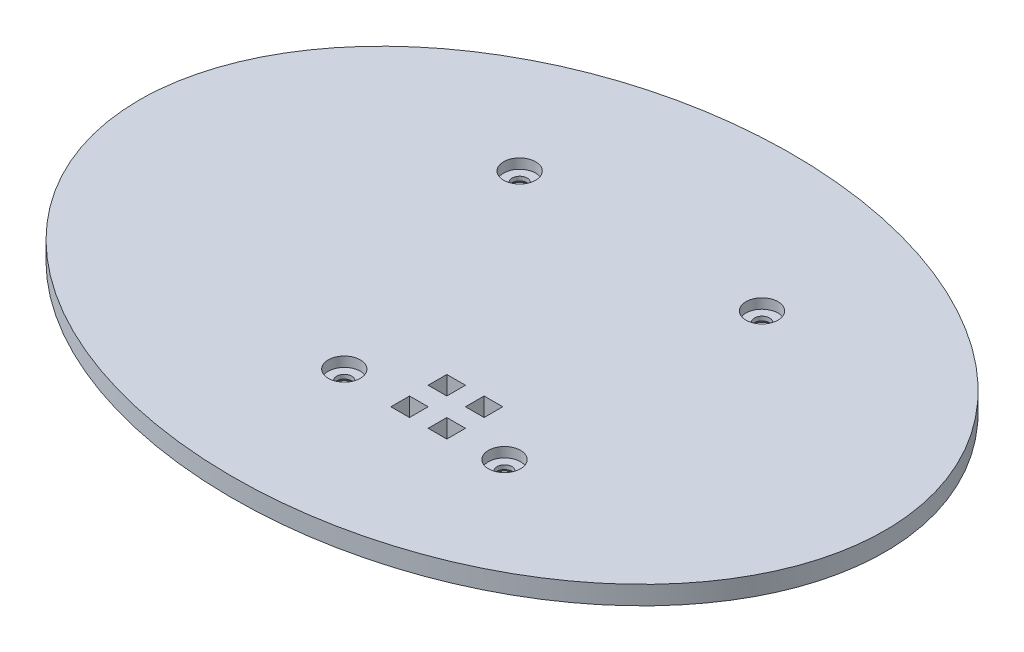
from build123d import *

# Parameters (mm, degrees)
SKETCH2_RX                                   = 50.8
SKETCH2_RY                                   = 38.1
TOP_DEPTH                                    = 2.54
SKETCH4_W                                    = 2.54
SKETCH4_H                                    = 2.54
BUTTONS_DEPTH                                = 2.54
CBORE_FOR_1_PAN_HEAD_MACHINE_SCREW1_AT_COUNT = 2
CBORE_FOR_1_PAN_HEAD_MACHINE_SCREW1_AT_PITCH = 21.591313149
CBORE_FOR_1_PAN_HEAD_MACHINE_SCREW1_2_COUNT  = 2
CBORE_FOR_1_PAN_HEAD_MACHINE_SCREW1_2_PITCH  = 41.397620143
CBORE_FOR_1_PAN_HEAD_MACHINE_SCREW1_3_COUNT  = 2
CBORE_FOR_1_PAN_HEAD_MACHINE_SCREW1_3_PITCH  = 37.125190283


with BuildPart() as part:
    # Sketch2 → top (new body)
    with BuildSketch(Plane(origin=(0, 0, 0), x_dir=(1, 0, 0), z_dir=(0, 1, 0))):
        with Locations(Location((0, 0), (0, 0, 180))):
            Ellipse(SKETCH2_RX, SKETCH2_RY)
    extrude(amount=TOP_DEPTH)

    # Sketch4 → buttons (cut)
    with BuildSketch(Plane(origin=(0, 2.54, 0), x_dir=(1, 0, 0), z_dir=(0, 1, 0))):
        with Locations((8.89, -17.78)):
            Rectangle(SKETCH4_W, SKETCH4_H)
        with Locations((8.89, -12.7)):
            Rectangle(SKETCH4_W, SKETCH4_H)
        with Locations((3.81, -17.78)):
            Rectangle(SKETCH4_W, SKETCH4_H)
        with Locations((3.81, -12.7)):
            Rectangle(SKETCH4_W, SKETCH4_H)
    extrude(amount=-BUTTONS_DEPTH, mode=Mode.SUBTRACT)

    # Sketch5 → CBORE for #1 Pan Head Machine Screw1 (revolve, cut)
    with BuildSketch(Plane(origin=(-5.08, 2.54, 17.78), x_dir=(0, 0, 1), z_dir=(1, 0, 0))):
        Polygon((0, 0), (0, 2.54), (1.6637, 2.54), (1.0287, 1.905), (1.0287, 1.3462), (2.18313, 1.3462), (2.18313, 0), align=None)
    cbore_for_1_pan_head_machine_screw1 = revolve(axis=Axis((-5.08, 8.89, 17.78), (0, -1, 0)), mode=Mode.SUBTRACT)

    # CBORE for #1 Pan Head Machine Screw1 at: CBORE for #1 Pan Head Machine Screw1 ×2
    with Locations(*[Vector(0.9999391815868314, 0, -0.011028740973384169) * (i * CBORE_FOR_1_PAN_HEAD_MACHINE_SCREW1_AT_PITCH) for i in range(1, CBORE_FOR_1_PAN_HEAD_MACHINE_SCREW1_AT_COUNT)]):
        add(cbore_for_1_pan_head_machine_screw1, mode=Mode.SUBTRACT)

    # CBORE for _1 Pan Head Machine Screw1 2: CBORE for #1 Pan Head Machine Screw1 ×2
    with Locations(*[Vector(0.5215275642742045, 0, -0.8532344341986062) * (i * CBORE_FOR_1_PAN_HEAD_MACHINE_SCREW1_2_PITCH) for i in range(1, CBORE_FOR_1_PAN_HEAD_MACHINE_SCREW1_2_COUNT)]):
        add(cbore_for_1_pan_head_machine_screw1, mode=Mode.SUBTRACT)

    # CBORE for _1 Pan Head Machine Screw1 3: CBORE for #1 Pan Head Machine Screw1 ×2
    with Locations(*[Vector(-0.3078772098677194, 0, -0.9514260999384389) * (i * CBORE_FOR_1_PAN_HEAD_MACHINE_SCREW1_3_PITCH) for i in range(1, CBORE_FOR_1_PAN_HEAD_MACHINE_SCREW1_3_COUNT)]):
        add(cbore_for_1_pan_head_machine_screw1, mode=Mode.SUBTRACT)


solid = part.part
